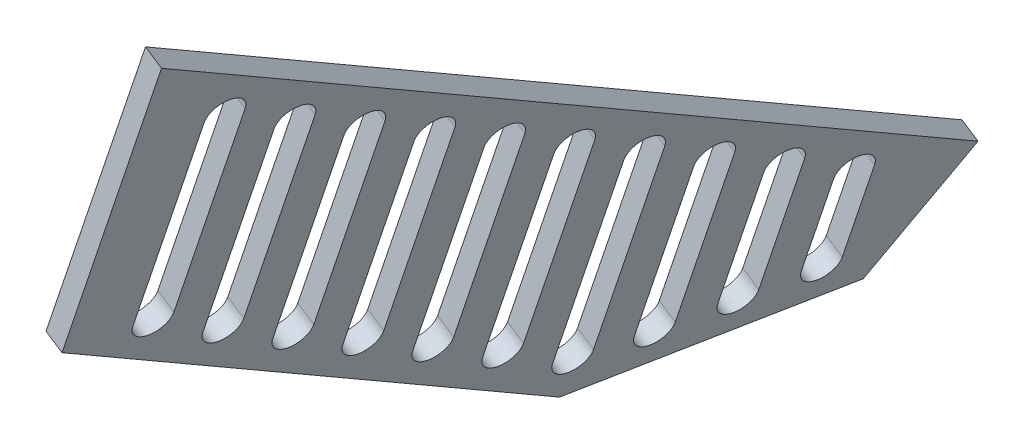
from build123d import *

# Parameters (mm, degrees)
BOSS_EXTRUDE1_DEPTH = 3
CUT_EXTRUDE1_DEPTH  = 3


with BuildPart() as part:
    # Sketch1 → Boss-Extrude1 (new body)
    with BuildSketch(Plane(origin=(905.138167722, -304.220768873, 175.641942808), x_dir=(0.30759635952956443, 0.9496429323245273, 0.05968903324926878), z_dir=(0.93225296918261, -0.31333416839864964, 0.18090356647709926))):
        Polygon((1336.603243515, 823.36292304), (1336.603243515, 786.922112317), (1353.172082537, 776.660923578), (1422.972443763, 889.368230522), (1379.131598091, 892.033861538), align=None)
    extrude(amount=BOSS_EXTRUDE1_DEPTH)

    # Sketch2 → Cut-Extrude1 (cut)
    with BuildSketch(Plane(origin=(907.934926629, -305.160771378, 176.184653507), x_dir=(0.3075963595295644, 0.9496429323245272, 0.05968903324926854), z_dir=(0.9322529691826101, -0.31333416839864964, 0.1809035664770987))):
        with BuildLine():
            Line((1372.635041062, 868.847338584), (1404.006775812, 866.939860116))
            ThreePointArc((1404.006775812, 866.939860116), (1406.653893347, 869.283525783), (1404.31022768, 871.930643317))
            Line((1404.31022768, 871.930643317), (1372.938492929, 873.838121786))
            ThreePointArc((1372.938492929, 873.838121786), (1370.291375395, 871.494456119), (1372.635041062, 868.847338584))
        make_face()
        with BuildLine():
            Line((1366.655693934, 859.192429925), (1398.027428685, 857.284951457))
            ThreePointArc((1398.027428685, 857.284951457), (1400.674546219, 859.628617124), (1398.330880552, 862.275734658))
            Line((1398.330880552, 862.275734658), (1366.959145802, 864.183213127))
            ThreePointArc((1366.959145802, 864.183213127), (1364.312028267, 861.83954746), (1366.655693934, 859.192429925))
        make_face()
        with BuildLine():
            Line((1378.917840057, 883.493030445), (1410.289574807, 881.585551976))
            ThreePointArc((1410.289574807, 881.585551976), (1412.633240474, 878.938434442), (1409.98612294, 876.594768775))
            Line((1409.98612294, 876.594768775), (1378.614388189, 878.502247244))
            ThreePointArc((1378.614388189, 878.502247244), (1376.270722522, 881.149364778), (1378.917840057, 883.493030445))
        make_face()
        with BuildLine():
            Line((1360.676346807, 849.537521266), (1392.048081557, 847.630042798))
            ThreePointArc((1392.048081557, 847.630042798), (1394.695199092, 849.973708465), (1392.351533425, 852.620825999))
            Line((1392.351533425, 852.620825999), (1360.979798674, 854.528304468))
            ThreePointArc((1360.979798674, 854.528304468), (1358.33268114, 852.184638801), (1360.676346807, 849.537521266))
        make_face()
        with BuildLine():
            Line((1354.696999679, 839.882612607), (1386.06873443, 837.975134139))
            ThreePointArc((1386.06873443, 837.975134139), (1388.715851964, 840.318799805), (1386.372186298, 842.96591734))
            Line((1386.372186298, 842.96591734), (1355.000451547, 844.873395809))
            ThreePointArc((1355.000451547, 844.873395809), (1352.353334012, 842.529730142), (1354.696999679, 839.882612607))
        make_face()
        with BuildLine():
            Line((1348.717652552, 830.227703948), (1380.089387303, 828.320225479))
            ThreePointArc((1380.089387303, 828.320225479), (1382.736504837, 830.663891146), (1380.39283917, 833.311008681))
            Line((1380.39283917, 833.311008681), (1349.021104419, 835.21848715))
            ThreePointArc((1349.021104419, 835.21848715), (1346.373986885, 832.874821483), (1348.717652552, 830.227703948))
        make_face()
        with BuildLine():
            Line((1342.738305424, 820.572795289), (1374.110040175, 818.66531682))
            ThreePointArc((1374.110040175, 818.66531682), (1376.75715771, 821.008982487), (1374.413492043, 823.656100022))
            Line((1374.413492043, 823.656100022), (1343.041757292, 825.563578491))
            ThreePointArc((1343.041757292, 825.563578491), (1340.394639758, 823.219912824), (1342.738305424, 820.572795289))
        make_face()
        with BuildLine():
            Line((1342.254969449, 815.592949483), (1368.434144915, 814.001191363))
            ThreePointArc((1368.434144915, 814.001191363), (1370.777810582, 811.354073828), (1368.130693048, 809.010408161))
            Line((1368.130693048, 809.010408161), (1341.951517581, 810.602166281))
            ThreePointArc((1341.951517581, 810.602166281), (1339.607851914, 813.249283816), (1342.254969449, 815.592949483))
        make_face()
        with BuildLine():
            Line((1342.254969449, 805.574481843), (1362.454797788, 804.346282704))
            ThreePointArc((1362.454797788, 804.346282704), (1364.798463455, 801.699165169), (1362.15134592, 799.355499502))
            Line((1362.15134592, 799.355499502), (1341.951517581, 800.583698642))
            ThreePointArc((1341.951517581, 800.583698642), (1339.607851914, 803.230816176), (1342.254969449, 805.574481843))
        make_face()
        with BuildLine():
            Line((1342.254969449, 795.556014204), (1356.47545066, 794.691374045))
            ThreePointArc((1356.47545066, 794.691374045), (1358.819116327, 792.04425651), (1356.171998793, 789.700590843))
            Line((1356.171998793, 789.700590843), (1341.951517581, 790.565231002))
            ThreePointArc((1341.951517581, 790.565231002), (1339.607851914, 793.212348537), (1342.254969449, 795.556014204))
        make_face()
    extrude(amount=-CUT_EXTRUDE1_DEPTH, mode=Mode.SUBTRACT)


solid = part.part
